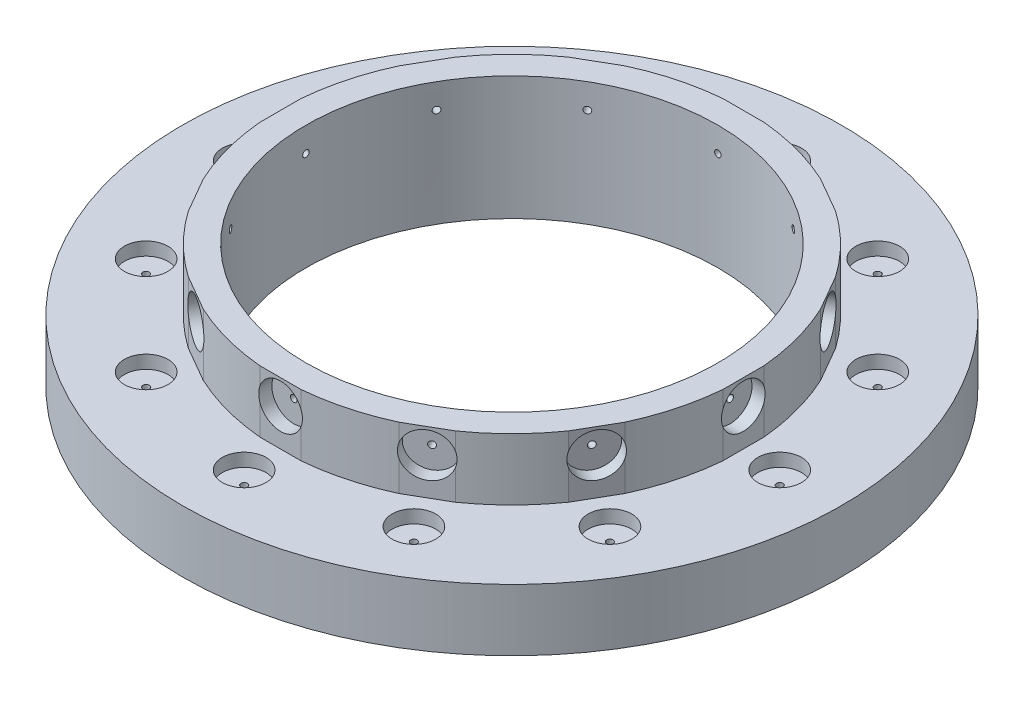
from build123d import *

# Parameters (mm, degrees)
SKETCH1_R                = 400
SKETCH1_R_2              = 250
BOSS_EXTRUDE1_DEPTH      = 150
CUT_EXTRUDE1_START       = -75
SKETCH2_R                = 400
SKETCH2_R_2              = 282
CUT_EXTRUDE1_DEPTH       = 75
SKETCH3_R                = 26.5
CUT_EXTRUDE2_DEPTH       = 16
CUT_EXTRUDE3_START       = -75
CUT_EXTRUDE3_DEPTH       = 75
SKETCH7_R                = 26.5
CUT_EXTRUDE4_DEPTH       = 16
CIRPATTERN1_START        = -282.0000001
CIRPATTERN1_OUTLINE_W    = 558
CIRPATTERN1_OUTLINE_H    = 76
CIRPATTERN1_DEPTH        = 1.110342049
CIRPATTERN1_START_2      = 280.889658051
CIRPATTERN1_2_OUTLINE_W  = 558
CIRPATTERN1_2_OUTLINE_H  = 76
CIRPATTERN1_2_DEPTH      = 1.110342049
CIRPATTERN1_START_3      = -280.889658051
CIRPATTERN1_3_OUTLINE_R  = 26.5
CIRPATTERN1_3_DEPTH      = 16
CIRPATTERN1_START_4      = 264.889658051
CIRPATTERN1_4_OUTLINE_R  = 26.5
CIRPATTERN1_4_DEPTH      = 16
CIRPATTERN1_START_5      = -264.889658051
CIRPATTERN1_5_OUTLINE_R  = 3.96875
CIRPATTERN1_5_DEPTH      = 529.779316102
CIRPATTERN1_6_OUTLINE_R  = 26.5
CIRPATTERN1_6_DEPTH      = 17.110342049
CIRPATTERN1_7_OUTLINE_R  = 26.5
CIRPATTERN1_7_DEPTH      = 17.110342049
CIRPATTERN1_8_OUTLINE_W  = 440
CIRPATTERN1_8_OUTLINE_H  = 76
CIRPATTERN1_8_OUTLINE_R  = 26.5
CIRPATTERN1_8_DEPTH      = 1.110342049
CIRPATTERN1_9_OUTLINE_W  = 440
CIRPATTERN1_9_OUTLINE_H  = 76
CIRPATTERN1_9_OUTLINE_R  = 26.5
CIRPATTERN1_9_DEPTH      = 1.110342049
CIRPATTERN1_10_OUTLINE_R = 3.96875
CIRPATTERN1_10_DEPTH     = 529.779316102
CIRPATTERN1_11_OUTLINE_R = 26.5
CIRPATTERN1_11_DEPTH     = 17.110342049
CIRPATTERN1_12_OUTLINE_R = 26.5
CIRPATTERN1_12_DEPTH     = 17.110342049
CIRPATTERN1_13_OUTLINE_W = 76
CIRPATTERN1_13_OUTLINE_H = 352
CIRPATTERN1_13_OUTLINE_R = 26.5
CIRPATTERN1_13_DEPTH     = 1.110342049
CIRPATTERN1_14_OUTLINE_W = 76
CIRPATTERN1_14_OUTLINE_H = 352
CIRPATTERN1_14_OUTLINE_R = 26.5
CIRPATTERN1_14_DEPTH     = 1.110342049
CIRPATTERN1_15_OUTLINE_R = 3.96875
CIRPATTERN1_15_DEPTH     = 529.779316102
CIRPATTERN1_16_OUTLINE_R = 26.5
CIRPATTERN1_16_DEPTH     = 17.110342049
CIRPATTERN1_17_OUTLINE_R = 26.5
CIRPATTERN1_17_DEPTH     = 17.110342049
CIRPATTERN1_18_OUTLINE_W = 440
CIRPATTERN1_18_OUTLINE_H = 76
CIRPATTERN1_18_OUTLINE_R = 26.5
CIRPATTERN1_18_DEPTH     = 1.110342049
CIRPATTERN1_19_OUTLINE_W = 440
CIRPATTERN1_19_OUTLINE_H = 76
CIRPATTERN1_19_OUTLINE_R = 26.5
CIRPATTERN1_19_DEPTH     = 1.110342049
CIRPATTERN1_20_OUTLINE_R = 3.96875
CIRPATTERN1_20_DEPTH     = 529.779316102
CIRPATTERN1_21_OUTLINE_W = 557
CIRPATTERN1_21_OUTLINE_H = 76
CIRPATTERN1_21_DEPTH     = 1.110342049
CIRPATTERN1_22_OUTLINE_W = 557
CIRPATTERN1_22_OUTLINE_H = 76
CIRPATTERN1_22_DEPTH     = 1.110342049
CIRPATTERN1_23_OUTLINE_R = 26.5
CIRPATTERN1_23_DEPTH     = 16
CIRPATTERN1_24_OUTLINE_R = 26.5
CIRPATTERN1_24_DEPTH     = 16
CIRPATTERN1_25_OUTLINE_R = 3.96875
CIRPATTERN1_25_DEPTH     = 529.779316102
CIRPATTERN1_26_OUTLINE_W = 643
CIRPATTERN1_26_OUTLINE_H = 76
CIRPATTERN1_26_DEPTH     = 1.110342049
CIRPATTERN1_27_OUTLINE_R = 26.5
CIRPATTERN1_27_DEPTH     = 16
CIRPATTERN1_START_6      = 249.968495961
CIRPATTERN1_28_OUTLINE_R = 3.96875
CIRPATTERN1_28_DEPTH     = 14.92116209


# Read off the part's stored shape, not the designer's step: CirPattern1
with BuildPart() as part:
    # Sketch1 → Boss-Extrude1 (new body)
    with BuildSketch(Plane(origin=(0, 0, 0), x_dir=(1, 0, 0), z_dir=(0, 1, 0))):
        with Locations(Location((0, 0, 0), (0, 0, 270))):
            Circle(SKETCH1_R)
        with Locations(Location((0, 0, 0), (0, 0, 270))):
            Circle(SKETCH1_R_2, mode=Mode.SUBTRACT)
    extrude(amount=BOSS_EXTRUDE1_DEPTH)

    # Sketch2 → Cut-Extrude1 (cut)
    with BuildSketch(Plane(origin=(0, 150, 0), x_dir=(1, 0, 0), z_dir=(0, 1, 0)).offset(CUT_EXTRUDE1_START)):
        with Locations(Location((0, 0, 0), (0, 0, 270))):
            Circle(SKETCH2_R)
        with Locations(Location((0, 0, 0), (0, 0, 270))):
            Circle(SKETCH2_R_2, mode=Mode.SUBTRACT)
    extrude(amount=CUT_EXTRUDE1_DEPTH, mode=Mode.SUBTRACT)

    # Sketch3 → Cut-Extrude2 (cut)
    with BuildSketch(Plane(origin=(0, 75, 0), x_dir=(1, 0, 0), z_dir=(0, 1, 0))):
        with Locations(Location((0, 325, 0), (0, 0, 270))):
            Circle(SKETCH3_R)
    extrude(amount=-CUT_EXTRUDE2_DEPTH, mode=Mode.SUBTRACT)

    # Sketch6 → Cut-Extrude3 (cut)
    with BuildSketch(Plane(origin=(0, 150, 0), x_dir=(1, 0, 0), z_dir=(0, 1, 0)).offset(CUT_EXTRUDE3_START)):
        with BuildLine():
            Line((-25, 280.889658051), (25, 280.889658051))
            ThreePointArc((25, 280.889658051), (0, 282), (-25, 280.889658051))
        make_face()
    extrude(amount=CUT_EXTRUDE3_DEPTH, mode=Mode.SUBTRACT)

    # Sketch7 → Cut-Extrude4 (cut)
    with BuildSketch(Plane(origin=(0, 0, -280.889658051), x_dir=(-1, 0, 0), z_dir=(0, 0, -1))):
        with Locations((0, 120)):
            Circle(SKETCH7_R)
    extrude(amount=-CUT_EXTRUDE4_DEPTH, mode=Mode.SUBTRACT)

    # Sketch4 → 5/16-18 Tapped Hole1 (revolve, cut)
    with BuildSketch(Plane(origin=(0, 59, -325), x_dir=(0, 0, 1), z_dir=(1, 0, 0))):
        Polygon((0, 0), (0, 25.071148974), (3.2639, 23.11), (3.2639, 16), (3.96875, 16), (3.96875, 0), align=None)
    revolve(axis=Axis((0, 65.35, -325), (0, -1, 0)), mode=Mode.SUBTRACT)

    # Sketch4 at point 2 (carried to point 2, square into its face) → 5/16-18 Tapped Hole1 at 2 (revolve, cut)
    with BuildSketch(Plane(origin=(0, 120, -264.889658051), x_dir=(0, 1, 0), z_dir=(1, 0, 0))):
        Polygon((0, 0), (0, 25.071148974), (3.2639, 23.11), (3.2639, 16), (3.96875, 16), (3.96875, 0), align=None)
    revolve(axis=Axis((0, 120, -271.239658051), (0, 0, 1)), mode=Mode.SUBTRACT)

    # CirPattern1 outline → CirPattern1 (cut)
    with BuildSketch(Plane(origin=(0, 0, 0), x_dir=(0.8660254037844449, 0, -0.49999999999998906), z_dir=(0.499999999999989, 0, 0.866025403784445)).offset(CIRPATTERN1_START)):
        with Locations((-5, 113)):
            Rectangle(CIRPATTERN1_OUTLINE_W, CIRPATTERN1_OUTLINE_H)
    extrude(amount=CIRPATTERN1_DEPTH, mode=Mode.SUBTRACT)

    # CirPattern1 2 outline → CirPattern1 2 (cut)
    with BuildSketch(Plane(origin=(0, 0, 0), x_dir=(0.8660254037844449, 0, -0.49999999999998906), z_dir=(0.499999999999989, 0, 0.866025403784445)).offset(CIRPATTERN1_START_2)):
        with Locations((-5, 113)):
            Rectangle(CIRPATTERN1_2_OUTLINE_W, CIRPATTERN1_2_OUTLINE_H)
    extrude(amount=CIRPATTERN1_2_DEPTH, mode=Mode.SUBTRACT)

    # CirPattern1 3 outline → CirPattern1 3 (cut)
    with BuildSketch(Plane(origin=(0, 0, 0), x_dir=(0.8660254037844449, 0, -0.49999999999998906), z_dir=(0.499999999999989, 0, 0.866025403784445)).offset(CIRPATTERN1_START_3)):
        with Locations((0, 120)):
            Circle(CIRPATTERN1_3_OUTLINE_R)
    extrude(amount=CIRPATTERN1_3_DEPTH, mode=Mode.SUBTRACT)

    # CirPattern1 4 outline → CirPattern1 4 (cut)
    with BuildSketch(Plane(origin=(0, 0, 0), x_dir=(0.8660254037844449, 0, -0.49999999999998906), z_dir=(0.499999999999989, 0, 0.866025403784445)).offset(CIRPATTERN1_START_4)):
        with Locations((0, 120)):
            Circle(CIRPATTERN1_4_OUTLINE_R)
    extrude(amount=CIRPATTERN1_4_DEPTH, mode=Mode.SUBTRACT)

    # CirPattern1 5 outline → CirPattern1 5 (cut)
    with BuildSketch(Plane(origin=(0, 0, 0), x_dir=(0.8660254037844449, 0, -0.49999999999998906), z_dir=(0.499999999999989, 0, 0.866025403784445)).offset(CIRPATTERN1_START_5)):
        with Locations((0, 120)):
            Circle(CIRPATTERN1_5_OUTLINE_R)
    extrude(amount=CIRPATTERN1_5_DEPTH, mode=Mode.SUBTRACT)

    # CirPattern1 6 outline → CirPattern1 6 (cut)
    with BuildSketch(Plane(origin=(0, 0, 0), x_dir=(0.5000000000000098, 0, -0.8660254037844329), z_dir=(0.8660254037844329, 0, 0.50000000000001)).offset(CIRPATTERN1_START)):
        with Locations((0, 120)):
            Circle(CIRPATTERN1_6_OUTLINE_R)
    extrude(amount=CIRPATTERN1_6_DEPTH, mode=Mode.SUBTRACT)

    # CirPattern1 7 outline → CirPattern1 7 (cut)
    with BuildSketch(Plane(origin=(0, 0, 0), x_dir=(0.5000000000000098, 0, -0.8660254037844329), z_dir=(0.8660254037844329, 0, 0.50000000000001)).offset(CIRPATTERN1_START_4)):
        with Locations((0, 120)):
            Circle(CIRPATTERN1_7_OUTLINE_R)
    extrude(amount=CIRPATTERN1_7_DEPTH, mode=Mode.SUBTRACT)

    # CirPattern1 8 outline → CirPattern1 8 (cut)
    with BuildSketch(Plane(origin=(0, 0, 0), x_dir=(0.5000000000000098, 0, -0.8660254037844329), z_dir=(0.8660254037844329, 0, 0.50000000000001)).offset(CIRPATTERN1_START)):
        with Locations((-63, 113)):
            Rectangle(CIRPATTERN1_8_OUTLINE_W, CIRPATTERN1_8_OUTLINE_H)
        with Locations((0, 120)):
            Circle(CIRPATTERN1_8_OUTLINE_R, mode=Mode.SUBTRACT)
    extrude(amount=CIRPATTERN1_8_DEPTH, mode=Mode.SUBTRACT)

    # CirPattern1 9 outline → CirPattern1 9 (cut)
    with BuildSketch(Plane(origin=(0, 0, 0), x_dir=(0.5000000000000098, 0, -0.8660254037844329), z_dir=(0.8660254037844329, 0, 0.50000000000001)).offset(CIRPATTERN1_START_2)):
        with Locations((-63, 113)):
            Rectangle(CIRPATTERN1_9_OUTLINE_W, CIRPATTERN1_9_OUTLINE_H)
        with Locations((0, 120)):
            Circle(CIRPATTERN1_9_OUTLINE_R, mode=Mode.SUBTRACT)
    extrude(amount=CIRPATTERN1_9_DEPTH, mode=Mode.SUBTRACT)

    # CirPattern1 10 outline → CirPattern1 10 (cut)
    with BuildSketch(Plane(origin=(0, 0, 0), x_dir=(0.5000000000000098, 0, -0.8660254037844329), z_dir=(0.8660254037844329, 0, 0.50000000000001)).offset(CIRPATTERN1_START_5)):
        with Locations((0, 120)):
            Circle(CIRPATTERN1_10_OUTLINE_R)
    extrude(amount=CIRPATTERN1_10_DEPTH, mode=Mode.SUBTRACT)

    # CirPattern1 11 outline → CirPattern1 11 (cut)
    with BuildSketch(Plane.YZ.offset(CIRPATTERN1_START)):
        with Locations((120, 0)):
            Circle(CIRPATTERN1_11_OUTLINE_R)
    extrude(amount=CIRPATTERN1_11_DEPTH, mode=Mode.SUBTRACT)

    # CirPattern1 12 outline → CirPattern1 12 (cut)
    with BuildSketch(Plane.YZ.offset(CIRPATTERN1_START_4)):
        with Locations((120, 0)):
            Circle(CIRPATTERN1_12_OUTLINE_R)
    extrude(amount=CIRPATTERN1_12_DEPTH, mode=Mode.SUBTRACT)

    # CirPattern1 13 outline → CirPattern1 13 (cut)
    with BuildSketch(Plane.YZ.offset(CIRPATTERN1_START)):
        with Locations((113, 148)):
            Rectangle(CIRPATTERN1_13_OUTLINE_W, CIRPATTERN1_13_OUTLINE_H)
        with Locations((120, 0)):
            Circle(CIRPATTERN1_13_OUTLINE_R, mode=Mode.SUBTRACT)
    extrude(amount=CIRPATTERN1_13_DEPTH, mode=Mode.SUBTRACT)

    # CirPattern1 14 outline → CirPattern1 14 (cut)
    with BuildSketch(Plane.YZ.offset(CIRPATTERN1_START_2)):
        with Locations((113, 148)):
            Rectangle(CIRPATTERN1_14_OUTLINE_W, CIRPATTERN1_14_OUTLINE_H)
        with Locations((120, 0)):
            Circle(CIRPATTERN1_14_OUTLINE_R, mode=Mode.SUBTRACT)
    extrude(amount=CIRPATTERN1_14_DEPTH, mode=Mode.SUBTRACT)

    # CirPattern1 15 outline → CirPattern1 15 (cut)
    with BuildSketch(Plane.YZ.offset(CIRPATTERN1_START_5)):
        with Locations((120, 0)):
            Circle(CIRPATTERN1_15_OUTLINE_R)
    extrude(amount=CIRPATTERN1_15_DEPTH, mode=Mode.SUBTRACT)

    # CirPattern1 16 outline → CirPattern1 16 (cut)
    with BuildSketch(Plane(origin=(0, 0, 0), x_dir=(0.49999999999999195, 0, 0.8660254037844434), z_dir=(0.8660254037844433, 0, -0.4999999999999921)).offset(CIRPATTERN1_START)):
        with Locations((0, -120)):
            Circle(CIRPATTERN1_16_OUTLINE_R)
    extrude(amount=CIRPATTERN1_16_DEPTH, mode=Mode.SUBTRACT)

    # CirPattern1 17 outline → CirPattern1 17 (cut)
    with BuildSketch(Plane(origin=(0, 0, 0), x_dir=(0.49999999999999195, 0, 0.8660254037844434), z_dir=(0.8660254037844433, 0, -0.4999999999999921)).offset(CIRPATTERN1_START_4)):
        with Locations((0, -120)):
            Circle(CIRPATTERN1_17_OUTLINE_R)
    extrude(amount=CIRPATTERN1_17_DEPTH, mode=Mode.SUBTRACT)

    # CirPattern1 18 outline → CirPattern1 18 (cut)
    with BuildSketch(Plane(origin=(0, 0, 0), x_dir=(0.49999999999999195, 0, 0.8660254037844434), z_dir=(0.8660254037844433, 0, -0.4999999999999921)).offset(CIRPATTERN1_START)):
        with Locations((58, -113)):
            Rectangle(CIRPATTERN1_18_OUTLINE_W, CIRPATTERN1_18_OUTLINE_H)
        with Locations((0, -120)):
            Circle(CIRPATTERN1_18_OUTLINE_R, mode=Mode.SUBTRACT)
    extrude(amount=CIRPATTERN1_18_DEPTH, mode=Mode.SUBTRACT)

    # CirPattern1 19 outline → CirPattern1 19 (cut)
    with BuildSketch(Plane(origin=(0, 0, 0), x_dir=(0.49999999999999195, 0, 0.8660254037844434), z_dir=(0.8660254037844433, 0, -0.4999999999999921)).offset(CIRPATTERN1_START_2)):
        with Locations((58, -113)):
            Rectangle(CIRPATTERN1_19_OUTLINE_W, CIRPATTERN1_19_OUTLINE_H)
        with Locations((0, -120)):
            Circle(CIRPATTERN1_19_OUTLINE_R, mode=Mode.SUBTRACT)
    extrude(amount=CIRPATTERN1_19_DEPTH, mode=Mode.SUBTRACT)

    # CirPattern1 20 outline → CirPattern1 20 (cut)
    with BuildSketch(Plane(origin=(0, 0, 0), x_dir=(0.49999999999999195, 0, 0.8660254037844434), z_dir=(0.8660254037844433, 0, -0.4999999999999921)).offset(CIRPATTERN1_START_5)):
        with Locations((0, -120)):
            Circle(CIRPATTERN1_20_OUTLINE_R)
    extrude(amount=CIRPATTERN1_20_DEPTH, mode=Mode.SUBTRACT)

    # CirPattern1 21 outline → CirPattern1 21 (cut)
    with BuildSketch(Plane(origin=(0, 0, 0), x_dir=(0.8660254037844346, 0, 0.5000000000000068), z_dir=(0.5000000000000068, 0, -0.8660254037844347)).offset(CIRPATTERN1_START)):
        with Locations((-2.5, -113)):
            Rectangle(CIRPATTERN1_21_OUTLINE_W, CIRPATTERN1_21_OUTLINE_H)
    extrude(amount=CIRPATTERN1_21_DEPTH, mode=Mode.SUBTRACT)

    # CirPattern1 22 outline → CirPattern1 22 (cut)
    with BuildSketch(Plane(origin=(0, 0, 0), x_dir=(0.8660254037844346, 0, 0.5000000000000068), z_dir=(0.5000000000000068, 0, -0.8660254037844347)).offset(CIRPATTERN1_START_2)):
        with Locations((-2.5, -113)):
            Rectangle(CIRPATTERN1_22_OUTLINE_W, CIRPATTERN1_22_OUTLINE_H)
    extrude(amount=CIRPATTERN1_22_DEPTH, mode=Mode.SUBTRACT)

    # CirPattern1 23 outline → CirPattern1 23 (cut)
    with BuildSketch(Plane(origin=(0, 0, 0), x_dir=(0.8660254037844346, 0, 0.5000000000000068), z_dir=(0.5000000000000068, 0, -0.8660254037844347)).offset(CIRPATTERN1_START_3)):
        with Locations((0, -120)):
            Circle(CIRPATTERN1_23_OUTLINE_R)
    extrude(amount=CIRPATTERN1_23_DEPTH, mode=Mode.SUBTRACT)

    # CirPattern1 24 outline → CirPattern1 24 (cut)
    with BuildSketch(Plane(origin=(0, 0, 0), x_dir=(0.8660254037844346, 0, 0.5000000000000068), z_dir=(0.5000000000000068, 0, -0.8660254037844347)).offset(CIRPATTERN1_START_4)):
        with Locations((0, -120)):
            Circle(CIRPATTERN1_24_OUTLINE_R)
    extrude(amount=CIRPATTERN1_24_DEPTH, mode=Mode.SUBTRACT)

    # CirPattern1 25 outline → CirPattern1 25 (cut)
    with BuildSketch(Plane(origin=(0, 0, 0), x_dir=(0.8660254037844346, 0, 0.5000000000000068), z_dir=(0.5000000000000068, 0, -0.8660254037844347)).offset(CIRPATTERN1_START_5)):
        with Locations((0, -120)):
            Circle(CIRPATTERN1_25_OUTLINE_R)
    extrude(amount=CIRPATTERN1_25_DEPTH, mode=Mode.SUBTRACT)

    # CirPattern1 26 outline → CirPattern1 26 (cut)
    with BuildSketch(Plane.XY.offset(CIRPATTERN1_START_2)):
        with Locations((-4.5, 113)):
            Rectangle(CIRPATTERN1_26_OUTLINE_W, CIRPATTERN1_26_OUTLINE_H)
    extrude(amount=CIRPATTERN1_26_DEPTH, mode=Mode.SUBTRACT)

    # CirPattern1 27 outline → CirPattern1 27 (cut)
    with BuildSketch(Plane.XY.offset(CIRPATTERN1_START_4)):
        with Locations((0, 120)):
            Circle(CIRPATTERN1_27_OUTLINE_R)
    extrude(amount=CIRPATTERN1_27_DEPTH, mode=Mode.SUBTRACT)

    # CirPattern1 28 outline → CirPattern1 28 (cut)
    with BuildSketch(Plane.XY.offset(CIRPATTERN1_START_6)):
        with Locations((0, 120)):
            Circle(CIRPATTERN1_28_OUTLINE_R)
    extrude(amount=CIRPATTERN1_28_DEPTH, mode=Mode.SUBTRACT)

    # CirPattern1 29 outline → CirPattern1 29 (revolve, cut)
    with BuildSketch(Plane(origin=(162.5, 0, -281.45825623), x_dir=(1, 0, 0), z_dir=(0, 0, 1))):
        Polygon((26.5, 75), (0, 75), (0, 33.928851026), (3.2639, 35.89), (3.2639, 43), (3.96875, 43), (3.96875, 59), (26.5, 59), align=None)
    revolve(axis=Axis((162.5, 0, -281.45825623), (0, 1, 0)), mode=Mode.SUBTRACT)

    # CirPattern1 30 outline → CirPattern1 30 (revolve, cut)
    with BuildSketch(Plane(origin=(281.45825623, 0, -162.5), x_dir=(1, 0, 0), z_dir=(0, 0, 1))):
        Polygon((26.5, 75), (0, 75), (0, 33.928851026), (3.2639, 35.89), (3.2639, 43), (3.96875, 43), (3.96875, 59), (26.5, 59), align=None)
    revolve(axis=Axis((281.45825623, 0, -162.5), (0, 1, 0)), mode=Mode.SUBTRACT)

    # CirPattern1 31 outline → CirPattern1 31 (revolve, cut)
    with BuildSketch(Plane(origin=(325, 0, 0), x_dir=(1, 0, 0), z_dir=(0, 0, 1))):
        Polygon((26.5, 75), (0, 75), (0, 33.928851026), (3.2639, 35.89), (3.2639, 43), (3.96875, 43), (3.96875, 59), (26.5, 59), align=None)
    revolve(axis=Axis((325, 0, 0), (0, 1, 0)), mode=Mode.SUBTRACT)

    # CirPattern1 32 outline → CirPattern1 32 (revolve, cut)
    with BuildSketch(Plane(origin=(281.45825623, 0, 162.5), x_dir=(1, 0, 0), z_dir=(0, 0, 1))):
        Polygon((26.5, 75), (0, 75), (0, 33.928851026), (3.2639, 35.89), (3.2639, 43), (3.96875, 43), (3.96875, 59), (26.5, 59), align=None)
    revolve(axis=Axis((281.45825623, 0, 162.5), (0, 1, 0)), mode=Mode.SUBTRACT)

    # CirPattern1 33 outline → CirPattern1 33 (revolve, cut)
    with BuildSketch(Plane(origin=(162.5, 0, 281.45825623), x_dir=(1, 0, 0), z_dir=(0, 0, 1))):
        Polygon((26.5, 75), (0, 75), (0, 33.928851026), (3.2639, 35.89), (3.2639, 43), (3.96875, 43), (3.96875, 59), (26.5, 59), align=None)
    revolve(axis=Axis((162.5, 0, 281.45825623), (0, 1, 0)), mode=Mode.SUBTRACT)

    # CirPattern1 34 outline → CirPattern1 34 (revolve, cut)
    with BuildSketch(Plane.XY.offset(325)):
        Polygon((26.5, 75), (0, 75), (0, 33.928851026), (3.2639, 35.89), (3.2639, 43), (3.96875, 43), (3.96875, 59), (26.5, 59), align=None)
    revolve(axis=Axis((0, 0, 325), (0, 1, 0)), mode=Mode.SUBTRACT)

    # CirPattern1 35 outline → CirPattern1 35 (revolve, cut)
    with BuildSketch(Plane(origin=(-162.5, 0, 281.45825623), x_dir=(1, 0, 0), z_dir=(0, 0, 1))):
        Polygon((26.5, 75), (0, 75), (0, 33.928851026), (3.2639, 35.89), (3.2639, 43), (3.96875, 43), (3.96875, 59), (26.5, 59), align=None)
    revolve(axis=Axis((-162.5, 0, 281.45825623), (0, 1, 0)), mode=Mode.SUBTRACT)

    # CirPattern1 36 outline → CirPattern1 36 (revolve, cut)
    with BuildSketch(Plane(origin=(-281.45825623, 0, 162.5), x_dir=(1, 0, 0), z_dir=(0, 0, 1))):
        Polygon((26.5, 75), (0, 75), (0, 33.928851026), (3.2639, 35.89), (3.2639, 43), (3.96875, 43), (3.96875, 59), (26.5, 59), align=None)
    revolve(axis=Axis((-281.45825623, 0, 162.5), (0, 1, 0)), mode=Mode.SUBTRACT)

    # CirPattern1 37 outline → CirPattern1 37 (revolve, cut)
    with BuildSketch(Plane(origin=(-325, 0, 0), x_dir=(1, 0, 0), z_dir=(0, 0, 1))):
        Polygon((26.5, 75), (0, 75), (0, 33.928851026), (3.2639, 35.89), (3.2639, 43), (3.96875, 43), (3.96875, 59), (26.5, 59), align=None)
    revolve(axis=Axis((-325, 0, 0), (0, 1, 0)), mode=Mode.SUBTRACT)

    # CirPattern1 38 outline → CirPattern1 38 (revolve, cut)
    with BuildSketch(Plane(origin=(-281.45825623, 0, -162.5), x_dir=(1, 0, 0), z_dir=(0, 0, 1))):
        Polygon((26.5, 75), (0, 75), (0, 33.928851026), (3.2639, 35.89), (3.2639, 43), (3.96875, 43), (3.96875, 59), (26.5, 59), align=None)
    revolve(axis=Axis((-281.45825623, 0, -162.5), (0, 1, 0)), mode=Mode.SUBTRACT)

    # CirPattern1 39 outline → CirPattern1 39 (revolve, cut)
    with BuildSketch(Plane(origin=(-162.5, 0, -281.45825623), x_dir=(1, 0, 0), z_dir=(0, 0, 1))):
        Polygon((26.5, 75), (0, 75), (0, 33.928851026), (3.2639, 35.89), (3.2639, 43), (3.96875, 43), (3.96875, 59), (26.5, 59), align=None)
    revolve(axis=Axis((-162.5, 0, -281.45825623), (0, 1, 0)), mode=Mode.SUBTRACT)


solid = part.part
